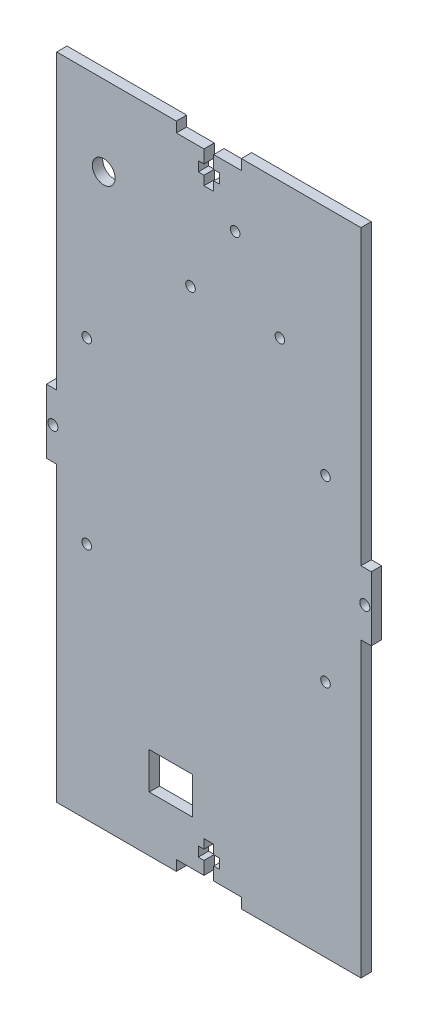
from build123d import *

# Parameters (mm, degrees)
SKETCH1_W           = 100
SKETCH1_H           = 200
BOSS_EXTRUDE2_DEPTH = 3.18
SKETCH2_R           = 1.55
SKETCH2_W           = 3.18
SKETCH2_H           = 90.125
CUT_EXTRUDE1_DEPTH  = 112.84861376
SKETCH5_R           = 1.47
CUT_EXTRUDE4_DEPTH  = 112.84861376
SKETCH6_R           = 1.47
CUT_EXTRUDE5_DEPTH  = 112.84861376
SKETCH7_R           = 3.5
CUT_EXTRUDE6_DEPTH  = 113.563018017
SKETCH4_W           = 13.35
SKETCH4_H           = 11.35
CUT_EXTRUDE7_DEPTH  = 112.84861376


with BuildPart() as part:
    # Sketch1 → Boss-Extrude2 (new body)
    with BuildSketch(Plane.XY):
        Rectangle(SKETCH1_W, SKETCH1_H)
    extrude(amount=BOSS_EXTRUDE2_DEPTH)

    # Sketch2 → Cut-Extrude1 (cut, through all)
    with BuildSketch(Plane.XY.offset(3.18)):
        with Locations((-48, 0)):
            Circle(SKETCH2_R)
        Polygon((-10, 100), (-10, 96.82), (-1.5, 96.82), (-1.5, 92.82), (-3.25, 92.82), (-3.25, 89.82), (-1.5, 89.82), (-1.5, 87), (1.5, 87), (1.5, 89.82), (3.25, 89.82), (3.25, 92.82), (1.5, 92.82), (1.5, 96.82), (10, 96.82), (10, 100), align=None)
        with Locations((-48.41, 54.9375)):
            Rectangle(SKETCH2_W, SKETCH2_H)
        with Locations((-48.41, -54.9375)):
            Rectangle(SKETCH2_W, SKETCH2_H)
    cut_extrude1 = extrude(amount=-CUT_EXTRUDE1_DEPTH, mode=Mode.SUBTRACT)

    # Mirror1: Cut-Extrude1 across plane
    add(cut_extrude1.mirror(Plane.ZX), mode=Mode.SUBTRACT)

    # Mirror3: Cut-Extrude1 across plane
    add(cut_extrude1.mirror(Plane(origin=(0, 0, 0), x_dir=(0, 0, 1), z_dir=(1, 0, 0))), mode=Mode.SUBTRACT)

    # Sketch5 → Cut-Extrude4 (cut, through all)
    with BuildSketch(Plane.XY.offset(3.18)):
        with Locations((-37.58090562, 28.464149283)):
            Circle(SKETCH5_R)
        with Locations((35.904481485, 28.464149283)):
            Circle(SKETCH5_R)
        with Locations((-37.58090562, -26.535850717)):
            Circle(SKETCH5_R)
        with Locations((35.904481485, -26.535850717)):
            Circle(SKETCH5_R)
    extrude(amount=-CUT_EXTRUDE4_DEPTH, mode=Mode.SUBTRACT)

    # Sketch6 → Cut-Extrude5 (cut, through all)
    with BuildSketch(Plane.XY.offset(3.18)):
        with Locations((-5.638260743, 58.12)):
            Circle(SKETCH6_R)
        with Locations((8.111739257, 79.62)):
            Circle(SKETCH6_R)
        with Locations((21.861739257, 58.12)):
            Circle(SKETCH6_R)
    extrude(amount=-CUT_EXTRUDE5_DEPTH, mode=Mode.SUBTRACT)

    # Sketch7 → Cut-Extrude6 (cut, through all)
    with BuildSketch(Plane.XY.offset(13.055)):
        with Locations((-32.354349711, 75.303329325)):
            Circle(SKETCH7_R)
    extrude(amount=-CUT_EXTRUDE6_DEPTH, mode=Mode.SUBTRACT)

    # Sketch4 → Cut-Extrude7 (cut, through all)
    with BuildSketch(Plane.XY.offset(3.18)):
        with Locations((-11.677157219, -77.351093612)):
            Rectangle(SKETCH4_W, SKETCH4_H)
    extrude(amount=-CUT_EXTRUDE7_DEPTH, mode=Mode.SUBTRACT)


solid = part.part
